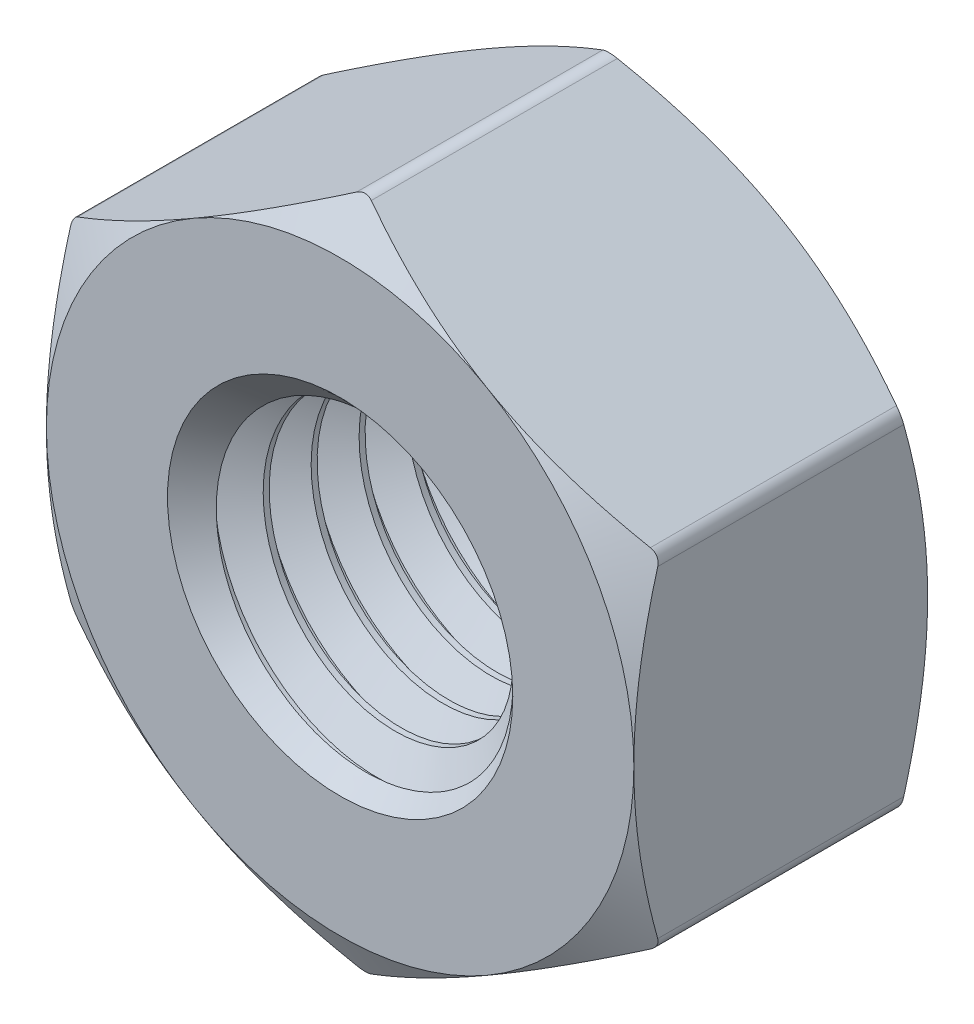
from build123d import *

# Parameters (mm, degrees)
BOSS_EXTRUDE2_DEPTH     = 2.778125
CUT_EXTRUDE4_DEPTH      = 9.930422423
CUT_EXTRUDE4_DEPTH_BACK = 9.930422423
SKETCH16_R              = 3.175
SKETCH7_OUTSIDE_W       = 55.29
SKETCH7_OUTSIDE_H       = 57.01
SKETCH7_OUTSIDE_R       = 5.55625
CUT_EXTRUDE5_DEPTH      = 11.1442782
CUT_EXTRUDE5_DRAFT      = -60
MIRROR4_COPY_1_SKETCH_W = 55.29
MIRROR4_COPY_1_SKETCH_H = 57.01
MIRROR4_COPY_1_SKETCH_R = 5.55625
MIRROR4_COPY_1_DEPTH    = 11.1442782
MIRROR4_COPY_1_DRAFT    = -60
FILLET2_R               = 0.2778125
SKETCH13_R              = 3.175
BOSS_EXTRUDE1_DEPTH     = 5.55625
CUT_SWEEP1_PITCH        = 0.907142857
SKETCH17_R              = 3.175
BOSS_EXTRUDE3_DEPTH     = 5.55625


with BuildPart() as part:
    # Sketch15 → Boss-Extrude2 (new, symmetric)
    with BuildSketch(Plane.XY):
        Polygon((0, 6.415804866), (-5.55625, 3.207902433), (-5.55625, -3.207902433), (0, -6.415804866), (5.55625, -3.207902433), (5.55625, 3.207902433), align=None)
    extrude(amount=BOSS_EXTRUDE2_DEPTH, both=True)

    # Sketch16 → Cut-Extrude4 (cut, two sides: drawn at the far end of the back side and taken through both)
    with BuildSketch(Plane.XY.offset(-CUT_EXTRUDE4_DEPTH_BACK)):
        Circle(SKETCH16_R)
    extrude(amount=CUT_EXTRUDE4_DEPTH + CUT_EXTRUDE4_DEPTH_BACK, mode=Mode.SUBTRACT)


with BuildPart() as cut_extrude5_tool:
    # Sketch7 outside → Cut-Extrude5 (with draft: the straight prism first)
    with BuildSketch(Plane.XY.offset(2.778125)):
        Rectangle(SKETCH7_OUTSIDE_W, SKETCH7_OUTSIDE_H)
        Circle(SKETCH7_OUTSIDE_R, mode=Mode.SUBTRACT)
    extrude(amount=-CUT_EXTRUDE5_DEPTH)
    # Cut-Extrude5: the draft: its side faces are tilted about the plane it starts from
    cut_extrude5_sides = [cut_extrude5_tool.faces().sort_by_distance(p)[0] for p in [
        (0, -28.505, -2.7940141),
        (27.645, 0, -2.7940141),
        (0, 28.505, -2.7940141),
        (-27.645, 0, -2.7940141),
        (-5.55625, 0, -2.7940141),
    ]]
    draft(cut_extrude5_sides, Plane.XY.offset(2.778125), CUT_EXTRUDE5_DRAFT)


with BuildPart() as part_1:
    add(part.part)

    # Cut-Extrude5: cut by cut_extrude5_tool
    add(cut_extrude5_tool.part, mode=Mode.SUBTRACT)


with BuildPart() as mirror4_copy_1_tool:
    # Mirror4 copy 1 sketch → Mirror4 copy 1 (with draft: the straight prism first)
    with BuildSketch(Plane(origin=(0, 0, -2.778125), x_dir=(1, 0, 0), z_dir=(0, 0, -1))):
        Rectangle(MIRROR4_COPY_1_SKETCH_W, MIRROR4_COPY_1_SKETCH_H)
        Circle(MIRROR4_COPY_1_SKETCH_R, mode=Mode.SUBTRACT)
    extrude(amount=-MIRROR4_COPY_1_DEPTH)
    # Mirror4 copy 1: the draft: its side faces are tilted about the plane it starts from
    mirror4_copy_1_sides = [mirror4_copy_1_tool.faces().sort_by_distance(p)[0] for p in [
        (0, -28.505, 2.7940141),
        (27.645, 0, 2.7940141),
        (0, 28.505, 2.7940141),
        (-27.645, 0, 2.7940141),
        (-5.55625, 0, 2.7940141),
    ]]
    draft(mirror4_copy_1_sides, Plane(origin=(0, 0, -2.778125), x_dir=(1, 0, 0), z_dir=(0, 0, -1)), MIRROR4_COPY_1_DRAFT)


with BuildPart() as part_2:
    add(part_1.part)

    # Mirror4 copy 1: cut by mirror4_copy_1_tool
    add(mirror4_copy_1_tool.part, mode=Mode.SUBTRACT)

    # Fillet2
    fillet2_edges = [part_2.edges().sort_by_distance(p)[0] for p in [
        (-5.55625, 3.207902433, 0),
        (-5.55625, -3.207902433, 0),
        (0, -6.415804866, 0),
        (5.55625, -3.207902433, 0),
        (5.55625, 3.207902433, 0),
        (0, 6.415804866, 0),
    ]]
    fillet(fillet2_edges, radius=FILLET2_R)

    # Sketch17 → Boss-Extrude3 (add)
    with BuildSketch(Plane.XY.offset(2.778125)):
        Circle(SKETCH17_R)
    extrude(amount=-BOSS_EXTRUDE3_DEPTH)


with BuildPart() as body_2:
    # Sketch13 → Boss-Extrude1 (new body)
    with BuildSketch(Plane(origin=(0, 0, -2.778125), x_dir=(-1, 0, 0), z_dir=(0, 0, -1))):
        Circle(SKETCH13_R)
    extrude(amount=-BOSS_EXTRUDE1_DEPTH)

    # Cut-Sweep1: the profile of Sketch12 profile screwed along a right-hand helix of 7.125 turns, 8 arcs to a turn; built about Z, then put on its axis
    cut_sweep1_z = Axis((0, 0, 0), (0, 0, 1))
    cut_sweep1_corners = [(3.1753, 0, -0.793923205), (3.1753, 0, 0.000173205), (2.585793431, 0, -0.340178571), (2.585793431, 0, -0.453571429)]
    with BuildLine(mode=Mode.PRIVATE) as cut_sweep1_profile:
        Line(cut_sweep1_corners[0], cut_sweep1_corners[1])
        Line(cut_sweep1_corners[1], cut_sweep1_corners[2])
        Line(cut_sweep1_corners[2], cut_sweep1_corners[3])
        Line(cut_sweep1_corners[3], cut_sweep1_corners[0])
    cut_sweep1_cap = Face(cut_sweep1_profile.wire())
    cut_sweep1_turn_angles = [0, 22.5, 45, 67.5, 90, 112.5, 135, 157.5, 180, 202.5, 225, 247.5, 270, 292.5, 315, 337.5, 360]
    cut_sweep1_turn_weights = [1, 0.9238795325112867, 1, 0.9238795325112867, 1, 0.9238795325112867, 1, 0.9238795325112867, 1, 0.9238795325112867, 1, 0.9238795325112867, 1, 0.9238795325112867, 1, 0.9238795325112867, 1]
    cut_sweep1_turn_rails = [Edge.make_bspline([Vector(p[0], p[1], 0).rotate(cut_sweep1_z, cut_sweep1_turn_angles[k]) / cut_sweep1_turn_weights[k] + Vector(0, 0, p[2] + CUT_SWEEP1_PITCH * cut_sweep1_turn_angles[k] / 360) for k in range(17)], [0, 0, 0, 1, 1, 2, 2, 3, 3, 4, 4, 5, 5, 6, 6, 7, 7, 8, 8, 8], 2, cut_sweep1_turn_weights) for p in cut_sweep1_corners]
    cut_sweep1_turn_sides = [Face.make_surface_from_curves(cut_sweep1_turn_rails[p[0]], cut_sweep1_turn_rails[p[1]]) for p in [(0, 1), (1, 2), (2, 3), (3, 0)]]
    cut_sweep1_last_angles = [2520, 2542.5, 2565]
    cut_sweep1_last_weights = [1, 0.923879532511349, 1]
    cut_sweep1_last_rails = [Edge.make_bspline([Vector(p[0], p[1], 0).rotate(cut_sweep1_z, cut_sweep1_last_angles[k]) / cut_sweep1_last_weights[k] + Vector(0, 0, p[2] + CUT_SWEEP1_PITCH * cut_sweep1_last_angles[k] / 360) for k in range(3)], [0, 0, 0, 1, 1, 1], 2, cut_sweep1_last_weights) for p in cut_sweep1_corners]
    cut_sweep1_last_sides = [Face.make_surface_from_curves(cut_sweep1_last_rails[p[0]], cut_sweep1_last_rails[p[1]]) for p in [(0, 1), (1, 2), (2, 3), (3, 0)]]
    cut_sweep1 = Plane(origin=(0, 0, -2.778125), x_dir=(0, 1, 0), z_dir=(0, 0, 1)) * Solid(Shell([*[p.moved(Location((0, 0, CUT_SWEEP1_PITCH * i))) for i in range(7) for p in cut_sweep1_turn_sides], *cut_sweep1_last_sides, cut_sweep1_cap, cut_sweep1_cap.rotate(cut_sweep1_z, 2565).moved(Location((0, 0, CUT_SWEEP1_PITCH * 2565 / 360)))]))
    add(cut_sweep1, mode=Mode.SUBTRACT)


with BuildPart() as part_3:
    add(part_2.part)

    # Combine1: cut body 2
    add(body_2.part, mode=Mode.SUBTRACT)

    # Cut-Extrude2 cone 1 section (through the dimple's axis) → Cut-Extrude2 (revolve, cut)
    with BuildSketch(Plane(origin=(0, 0, 2.778125), x_dir=(0, -1, 0), z_dir=(1, 0, 0))):
        Polygon((0, 0), (3.265714286, 0), (0, 3.265714286), align=None)
    revolve(axis=Axis((0, 0, 2.778125), (0, 0, -1)), mode=Mode.SUBTRACT)

    # Cut-Extrude3 cone 1 section (through the dimple's axis) → Cut-Extrude3 (revolve, cut)
    with BuildSketch(Plane(origin=(0, 0, -2.778125), x_dir=(0, 1, 0), z_dir=(1, 0, 0))):
        Polygon((0, 0), (3.265714286, 0), (0, 3.265714286), align=None)
    revolve(axis=Axis((0, 0, -2.778125), (0, 0, 1)), mode=Mode.SUBTRACT)


solid = part_3.part
